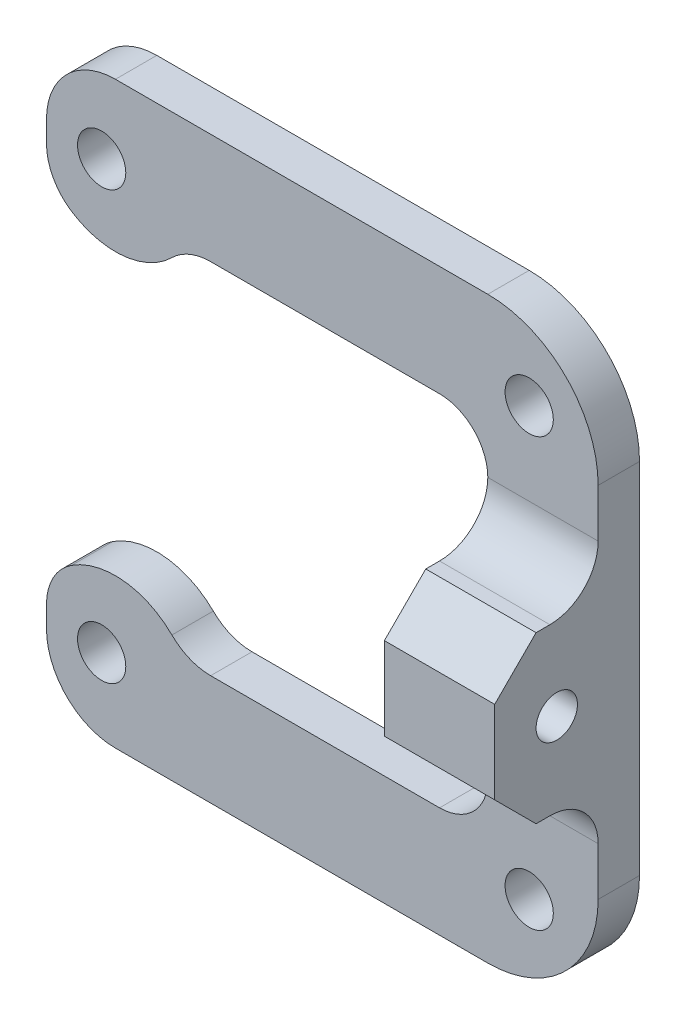
from build123d import *

# Parameters (mm, degrees)
SKETCH1_R           = 1.75
BOSS_EXTRUDE1_DEPTH = 3
SKETCH2_R           = 1.5
BOSS_EXTRUDE2_DEPTH = 8
FILLET1_R           = 3.5
CUT_EXTRUDE1_DEPTH  = 4


with BuildPart() as part:
    # Sketch1 → Boss-Extrude1 (new body)
    with BuildSketch(Plane.XY):
        with BuildLine():
            Line((-20, 16), (-20, 14.466251376))
            ThreePointArc((-20, 14.466251376), (-19.517003263, 12.560814931), (-18.184655977, 11.115538278))
            ThreePointArc((-18.184655977, 11.115538278), (-14.41606767, 10.198360315), (-10.905843198, 11.848147392))
            ThreePointArc((-10.905843198, 11.848147392), (-9.615070973, 12.700850549), (-8.097274802, 13))
            Line((-8.097274802, 13), (12, 13))
            Line((12, 13), (12, -13))
            Line((12, -13), (-8.097274802, -13))
            ThreePointArc((-8.097274802, -13), (-9.615070973, -12.700850549), (-10.905843198, -11.848147392))
            ThreePointArc((-10.905843198, -11.848147392), (-14.41606767, -10.198360315), (-18.184655977, -11.115538278))
            ThreePointArc((-18.184655977, -11.115538278), (-19.517003263, -12.560814931), (-20, -14.466251376))
            Line((-20, -14.466251376), (-20, -16))
            ThreePointArc((-20, -16), (-18.535533906, -19.535533906), (-15, -21))
            Line((-15, -21), (12, -21))
            ThreePointArc((12, -21), (17.656854249, -18.656854249), (20, -13))
            Line((20, -13), (20, 13))
            ThreePointArc((20, 13), (17.656854249, 18.656854249), (12, 21))
            Line((12, 21), (-15, 21))
            ThreePointArc((-15, 21), (-18.535533906, 19.535533906), (-20, 16))
        make_face()
        with Locations((15, 15.5)):
            Circle(SKETCH1_R, mode=Mode.SUBTRACT)
        with Locations((15, -15.5)):
            Circle(SKETCH1_R, mode=Mode.SUBTRACT)
        with Locations((-16, -15.5)):
            Circle(SKETCH1_R, mode=Mode.SUBTRACT)
        with Locations((-16, 15.5)):
            Circle(SKETCH1_R, mode=Mode.SUBTRACT)
    extrude(amount=BOSS_EXTRUDE1_DEPTH)

    # Sketch2 → Boss-Extrude2 (add)
    with BuildSketch(Plane(origin=(20, 0, 0), x_dir=(0, 0, -1), z_dir=(1, 0, 0))):
        Polygon((-10.5, 3), (-7.5, 6), (-3, 6), (-3, -6), (-7.5, -6), (-10.5, -3), align=None)
        with Locations(Location((-6, 0, 0), (0, 0, 90))):
            Circle(SKETCH2_R, mode=Mode.SUBTRACT)
    extrude(amount=-BOSS_EXTRUDE2_DEPTH)

    # Fillet1
    fillet1_edges = [part.edges().sort_by_distance(p)[0] for p in [
        (16, 6, 3),
        (16, -6, 3),
        (12, -13, 1.5),
        (12, 13, 1.5),
    ]]
    fillet(fillet1_edges, radius=FILLET1_R - 0.0001)  # a hair under: the kernel refuses the full size

    # Sketch3 → Cut-Extrude1 (cut)
    with BuildSketch(Plane.ZY.offset(-12)):
        Polygon((6, 3.175426481), (3.25, 1.58771324), (3.25, -1.58771324), (6, -3.175426481), (8.75, -1.58771324), (8.75, 1.58771324), align=None)
    extrude(amount=-CUT_EXTRUDE1_DEPTH, mode=Mode.SUBTRACT)


solid = part.part
